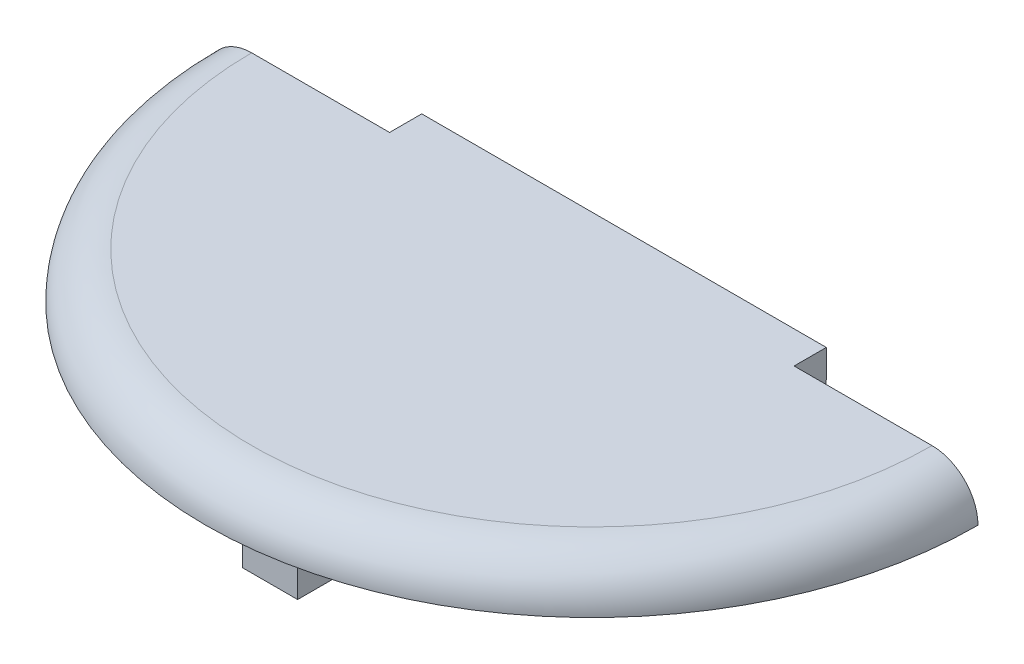
from build123d import *

# Parameters (mm, degrees)
CUT_EXTRUDE1_DEPTH       = 5
CUT_EXTRUDE3_DEPTH       = 45
SKETCH8_R                = 40
CUT_EXTRUDE4_DEPTH       = 32
SKETCH9_R                = 32
SKETCH9_R_2              = 24.5
CUT_EXTRUDE5_DEPTH       = 14
SKETCH10_R               = 26
CUT_EXTRUDE6_DEPTH       = 14
FILLET1_R                = 7
FILLET2_R                = 7
CUT_REVOLVE1_START       = 22
CUT_REVOLVE1_DEPTH       = 30.5
CUT_EXTRUDE12_DEPTH      = 5
SKETCH18_W               = 13
SKETCH18_H               = 8
CUT_EXTRUDE13_DEPTH      = 5
INTERSECT1_OUTLINE_R     = 42
INTERSECT1_DEPTH         = 55
SKETCH20_W               = 6
SKETCH20_H               = 3
BOSS_EXTRUDE1_DEPTH      = 8
BOSS_EXTRUDE2_DEPTH      = 1
BOSS_EXTRUDE2_DEPTH_BACK = 1
SKETCH21_W               = 6
SKETCH21_H               = 6
BOSS_EXTRUDE3_DEPTH      = 7
SKETCH19_R               = 1.5
CUT_EXTRUDE14_DEPTH      = 20
SKETCH23_W               = 20
SKETCH23_H               = 7
CUT_EXTRUDE15_DEPTH      = 7
SKETCH24_W               = 44
SKETCH24_H               = 3.5
CUT_EXTRUDE16_DEPTH      = 5
FILLET3_R                = 2


# Read off the part's stored shape, not the designer's step: Cut-Revolve1, Intersect1
with BuildPart() as part:
    # Sketch1 → Revolve1 (revolve)
    with BuildSketch(Plane.XY, mode=Mode.PRIVATE) as revolve1_sk:
        with BuildLine():
            Line((22.5, 0), (32, 0))
            ThreePointArc((32, 0), (33.414213562, 0.585786438), (34, 2))
            Line((34, 2), (34, 18))
            Line((34, 18), (40, 18))
            ThreePointArc((40, 18), (41.414213562, 18.585786438), (42, 20))
            Line((42, 20), (42, 55))
            ThreePointArc((42, 55), (40.535533906, 58.535533906), (37, 60))
            Line((37, 60), (0, 60))
            Line((0, 60), (0, 18))
            Line((0, 18), (22.5, 18))
            Line((22.5, 18), (22.5, 0))
        make_face()
    revolve(revolve1_sk.sketch.rotate(Axis((0, 2, 0), (0, 1, 0)), 90), axis=Axis((0, 2, 0), (0, 1, 0)))

    # Sketch5 → Cut-Extrude1 (cut)
    with BuildSketch(Plane(origin=(0, 60, 0), x_dir=(1, 0, 0), z_dir=(0, 1, 0))):
        with BuildLine():
            Line((-42, 0), (-40, 0))
            Line((-40, 0), (40, 0))
            Line((40, 0), (42, 0))
            ThreePointArc((42, 0), (0, 42), (-42, 0))
        make_face()
    extrude(amount=-CUT_EXTRUDE1_DEPTH, mode=Mode.SUBTRACT)

    # Sketch7 → Cut-Extrude3 (cut)
    with BuildSketch(Plane.XZ.offset(-18)):
        with BuildLine():
            Line((-21, 0), (21, 0))
            ThreePointArc((21, 0), (0, -21), (-21, 0))
        make_face()
    extrude(amount=-CUT_EXTRUDE3_DEPTH, mode=Mode.SUBTRACT)

    # Sketch8 → Cut-Extrude4 (cut)
    with BuildSketch(Plane(origin=(0, 52.5, 0), x_dir=(1, 0, 0), z_dir=(0, 1, 0))):
        with Locations(Location((0, 0, 0), (0, 0, 270))):
            Circle(SKETCH8_R)
        with BuildLine():
            Line((22.912878475, -2), (-22.912878475, -2))
            ThreePointArc((-22.912878475, -2), (0, 23), (22.912878475, -2))
        make_face(mode=Mode.SUBTRACT)
    extrude(amount=-CUT_EXTRUDE4_DEPTH, mode=Mode.SUBTRACT)

    # Sketch9 → Cut-Extrude5 (cut)
    with BuildSketch(Plane(origin=(0, 2, 0), x_dir=(-1, 0, 0), z_dir=(0, -1, 0))):
        with Locations(Location((0, 0, 0), (0, 0, 90))):
            Circle(SKETCH9_R)
        with Locations(Location((0, 0, 0), (0, 0, 90))):
            Circle(SKETCH9_R_2, mode=Mode.SUBTRACT)
    extrude(amount=-CUT_EXTRUDE5_DEPTH, mode=Mode.SUBTRACT)

    # Sketch10 → Cut-Extrude6 (cut)
    with BuildSketch(Plane(origin=(0, 2, 0), x_dir=(-1, 0, 0), z_dir=(0, -1, 0))):
        Circle(SKETCH10_R)
    extrude(amount=-CUT_EXTRUDE6_DEPTH, mode=Mode.SUBTRACT)

    # Fillet1
    fillet1_edges = [part.edges().sort_by_distance(p)[0] for p in [
        (21, 36.5, 0),
        (-21, 36.5, 0),
    ]]
    fillet(fillet1_edges, radius=FILLET1_R)

    # Fillet2
    fillet2_edges = [part.edges().sort_by_distance(p)[0] for p in [
        (-22.912878475, 36.5, 2),
        (22.912878475, 36.5, 2),
    ]]
    fillet(fillet2_edges, radius=FILLET2_R)

    # Cut-Revolve1 outline → Cut-Revolve1 (cut)
    with BuildSketch(Plane(origin=(0, 0, 0), x_dir=(1, 0, 0), z_dir=(0, 1, 0)).offset(CUT_REVOLVE1_START)):
        with BuildLine():
            Line((-34.641016151, -20), (-36.373066959, -21))
            ThreePointArc((-36.373066959, -21), (0, -42), (36.373066959, -21))
            Line((36.373066959, -21), (34.641016151, -20))
            ThreePointArc((34.641016151, -20), (0, -40), (-34.641016151, -20))
        make_face()
    extrude(amount=CUT_REVOLVE1_DEPTH, mode=Mode.SUBTRACT)

    # Sketch15 → Cut-Extrude12 (cut)
    with BuildSketch(Plane(origin=(0, 20.5, 0), x_dir=(1, 0, 0), z_dir=(0, 1, 0))):
        with BuildLine():
            Line((-28.124355653, -3.514579578), (-26.124355653, -3.514579578))
            ThreePointArc((-26.124355653, -3.514579578), (-24.710142091, -2.928793141), (-24.124355653, -1.514579578))
            Line((-24.124355653, -1.514579578), (-24.124355653, 8.485420422))
            ThreePointArc((-24.124355653, 8.485420422), (-24.710142091, 9.899633984), (-26.124355653, 10.485420422))
            Line((-26.124355653, 10.485420422), (-28.124355653, 10.485420422))
            ThreePointArc((-28.124355653, 10.485420422), (-29.538569215, 9.899633984), (-30.124355653, 8.485420422))
            Line((-30.124355653, 8.485420422), (-30.124355653, -1.514579578))
            ThreePointArc((-30.124355653, -1.514579578), (-29.538569215, -2.928793141), (-28.124355653, -3.514579578))
        make_face()
    extrude(amount=-CUT_EXTRUDE12_DEPTH, mode=Mode.SUBTRACT)

    # Sketch18 → Cut-Extrude13 (cut)
    with BuildSketch(Plane(origin=(0, 55, 0), x_dir=(1, 0, 0), z_dir=(0, 1, 0))):
        with Locations((0.796512215, 32.951769165)):
            Rectangle(SKETCH18_W, SKETCH18_H)
    extrude(amount=-CUT_EXTRUDE13_DEPTH, mode=Mode.SUBTRACT)

    # Intersect1 outline → Intersect1 (cut)
    with BuildSketch(Plane(origin=(0, 0, 0), x_dir=(1, 0, 0), z_dir=(0, 1, 0))):
        Circle(INTERSECT1_OUTLINE_R)
        with BuildLine():
            Line((12.124355653, 0), (-12.124355653, 0))
            ThreePointArc((-12.124355653, 0), (-18.186533479, 3.5), (-18.186533479, 10.5))
            ThreePointArc((-18.186533479, 10.5), (0, 21), (18.186533479, 10.5))
            ThreePointArc((18.186533479, 10.5), (18.186533479, 3.5), (12.124355653, 0))
        make_face(mode=Mode.SUBTRACT)
    extrude(amount=INTERSECT1_DEPTH, mode=Mode.SUBTRACT)

    # Sketch20 → Boss-Extrude1 (add)
    with BuildSketch(Plane.XZ.offset(-55)):
        with Locations((0, 33.5)):
            Rectangle(SKETCH20_W, SKETCH20_H)
    extrude(amount=BOSS_EXTRUDE1_DEPTH)

    # Sketch21 → Boss-Extrude2 (add, two sides: drawn at the far end of the back side and taken through both)
    with BuildSketch(Plane.XZ.offset(-47).offset(-BOSS_EXTRUDE2_DEPTH_BACK)):
        with Locations((0, 32)):
            Rectangle(SKETCH21_W, SKETCH21_H)
    extrude(amount=BOSS_EXTRUDE2_DEPTH + BOSS_EXTRUDE2_DEPTH_BACK)

    # Sketch22 → Boss-Extrude3 (add)
    with BuildSketch(Plane(origin=(0, 0, 0), x_dir=(-1, 0, 0), z_dir=(0, 0, -1))):
        with BuildLine():
            Line((-42, 55), (42, 55))
            ThreePointArc((42, 55), (40.535533906, 58.535533906), (37, 60))
            Line((37, 60), (-37, 60))
            ThreePointArc((-37, 60), (-40.535533906, 58.535533906), (-42, 55))
        make_face()
    extrude(amount=BOSS_EXTRUDE3_DEPTH)

    # Sketch19 → Cut-Extrude14 (cut)
    with BuildSketch(Plane(origin=(0, 0, -7), x_dir=(-1, 0, 0), z_dir=(0, 0, -1))):
        with Locations((0, 57.5)):
            Circle(SKETCH19_R)
        with Locations((-30, 57.5)):
            Circle(SKETCH19_R)
        with Locations((30, 57.5)):
            Circle(SKETCH19_R)
    extrude(amount=-CUT_EXTRUDE14_DEPTH, mode=Mode.SUBTRACT)

    # Sketch23 → Cut-Extrude15 (cut)
    with BuildSketch(Plane(origin=(0, 60, 0), x_dir=(1, 0, 0), z_dir=(0, 1, 0))):
        with Locations((-32, 3.5)):
            Rectangle(SKETCH23_W, SKETCH23_H)
        with Locations((32, 3.5)):
            Rectangle(SKETCH23_W, SKETCH23_H)
    extrude(amount=-CUT_EXTRUDE15_DEPTH, mode=Mode.SUBTRACT)

    # Sketch24 → Cut-Extrude16 (cut)
    with BuildSketch(Plane(origin=(0, 60, 0), x_dir=(1, 0, 0), z_dir=(0, 1, 0))):
        with Locations((0, 5.25)):
            Rectangle(SKETCH24_W, SKETCH24_H)
    extrude(amount=-CUT_EXTRUDE16_DEPTH, mode=Mode.SUBTRACT)

    # Fillet3
    # the kernel refuses this fillet: 2 mm, written as the material it takes off along each edge
    with BuildSketch(Plane(origin=(27, 55, -3.5), x_dir=(0, 0, 1), z_dir=(-1, 0, 0))) as fillet3_piece_1:
        with BuildLine():
            CenterArc((FILLET3_R, FILLET3_R), FILLET3_R, 180, 90)
            Line((0, FILLET3_R), (0, 0))
            Line((0, 0), (FILLET3_R, 0))
        make_face()
    extrude(amount=54, mode=Mode.SUBTRACT)


solid = part.part
